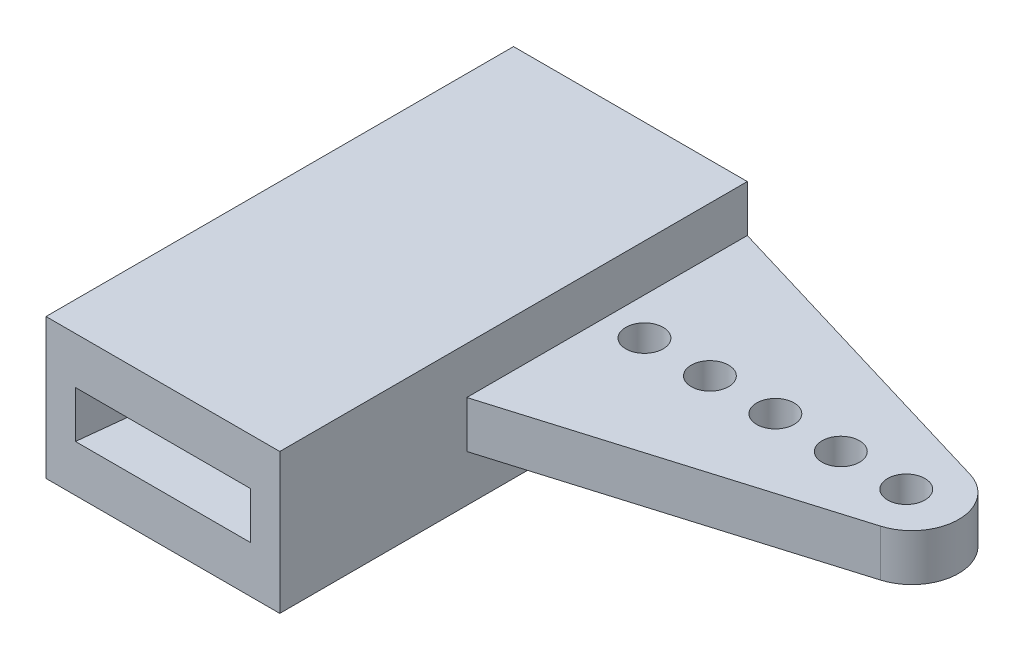
from build123d import *
from build123d.topology import SkipClean

# Parameters (mm, degrees)
SKETCH1_R               = 3.429
SKETCH1_R_2             = 2.286
BOSS_EXTRUDE1_DEPTH     = 3.556
BOSS_EXTRUDE2_START     = -1.27
BOSS_EXTRUDE2_DEPTH     = 1.27
BOSS_EXTRUDE3_START     = -1.27
SKETCH2_3_R             = 2.286
SKETCH2_3_R_2           = 1.27
BOSS_EXTRUDE3_DEPTH     = 0.254
SKETCH3_R               = 0.508
CUT_EXTRUDE1_DEPTH      = 17.020635974
LPATTERN1_COUNT         = 6
LPATTERN1_PITCH         = 1.778
CUT_EXTRUDE2_DEPTH      = 17.020635974
CUT_EXTRUDE2_DEPTH_BACK = 17.020635974
SKETCH4_W               = 4.326879353
SKETCH4_H               = 6.724216597
BOSS_EXTRUDE4_START     = 2.286
SKETCH5_R               = 0.508
BOSS_EXTRUDE4_DEPTH     = 1.27
COMBINE1_OUTLINE_R      = 0.508
COMBINE1_OUTLINE_R_2    = 1.27
COMBINE1_DEPTH          = 3.556
SKETCH6_W               = 6.35
SKETCH6_H               = 12.7
BOSS_EXTRUDE5_DEPTH     = 1.27
BOSS_EXTRUDE6_START     = -1.27
SKETCH6_2_W             = 6.35
SKETCH6_2_H             = 12.7
BOSS_EXTRUDE6_DEPTH     = 1.27
FILLET1_R               = 1.27


# Read off the part's stored shape, not the designer's step: Combine1
with BuildPart() as part:
    # Sketch1 → Boss-Extrude1 (new body)
    with BuildSketch(Plane(origin=(0, 0, 0), x_dir=(1, 0, 0), z_dir=(0, 1, 0))):
        with Locations(Location((0, 0, 0), (0, 0, 270))):
            Circle(SKETCH1_R)
        with Locations(Location((0, 0, 0), (0, 0, 270))):
            Circle(SKETCH1_R_2, mode=Mode.SUBTRACT)
    extrude(amount=BOSS_EXTRUDE1_DEPTH)

    # Sketch2 → Boss-Extrude2 (add)
    with BuildSketch(Plane(origin=(0, 3.556, 0), x_dir=(1, 0, 0), z_dir=(0, 1, 0)).offset(BOSS_EXTRUDE2_START)):
        with BuildLine():
            ThreePointArc((-2.54, 2.303571358), (-1.389081498, 3.135042837), (0, 3.429))
            Line((0, 3.429), (0, 15.24))
            ThreePointArc((0, 15.24), (-0.835660201, 14.92028345), (-1.244511661, 14.124427226))
            Line((-1.244511661, 14.124427226), (-2.54, 2.303571358))
        make_face()
        with BuildLine():
            Line((0, 15.24), (0, 3.429))
            ThreePointArc((0, 3.429), (1.389081498, 3.135042837), (2.54, 2.303571358))
            Line((2.54, 2.303571358), (1.244511661, 14.124427226))
            ThreePointArc((1.244511661, 14.124427226), (0.835660201, 14.92028345), (0, 15.24))
        make_face()
    extrude(amount=BOSS_EXTRUDE2_DEPTH)

    # Sketch2<3> → Boss-Extrude3 (add)
    with BuildSketch(Plane(origin=(0, 3.556, 0), x_dir=(1, 0, 0), z_dir=(0, 1, 0)).offset(BOSS_EXTRUDE3_START)):
        with Locations(Location((0, 0, 0), (0, 0, 270))):
            Circle(SKETCH2_3_R)
        with Locations(Location((0, 0, 0), (0, 0, 270))):
            Circle(SKETCH2_3_R_2, mode=Mode.SUBTRACT)
    extrude(amount=BOSS_EXTRUDE3_DEPTH)

    # Sketch3 → Cut-Extrude1 (cut, through all)
    with BuildSketch(Plane(origin=(0, 3.556, 0), x_dir=(1, 0, 0), z_dir=(0, 1, 0))):
        with Locations(Location((0, 5.08, 0), (0, 0, 270))):
            Circle(SKETCH3_R)
    cut_extrude1 = extrude(amount=-CUT_EXTRUDE1_DEPTH, mode=Mode.SUBTRACT)

    # LPattern1: Cut-Extrude1 ×6
    with Locations(*[(0, 0, -i * LPATTERN1_PITCH) for i in range(1, LPATTERN1_COUNT)]):
        add(cut_extrude1, mode=Mode.SUBTRACT)

    # Sketch4 → Cut-Extrude2 (cut, two sides: drawn at the far end of the back side and taken through both)
    with BuildSketch(Plane(origin=(0, 0, 0), x_dir=(0, 0, -1), z_dir=(1, 0, 0)).offset(-CUT_EXTRUDE2_DEPTH_BACK)):
        with Locations((-2.163439677, 3.362108299)):
            Rectangle(SKETCH4_W, SKETCH4_H)
    extrude(amount=CUT_EXTRUDE2_DEPTH + CUT_EXTRUDE2_DEPTH_BACK, mode=Mode.SUBTRACT)

    # Mirror1: part across plane


with BuildPart() as part_1:
    with SkipClean():  # the faces are left unmerged after this step: merging them gives an invalid solid
        add(part.part)
        add(part.part.mirror(Plane.XY))


with BuildPart() as body_2:
    # Sketch5 → Boss-Extrude4 (new body)
    with BuildSketch(Plane(origin=(0, 0, 0), x_dir=(1, 0, 0), z_dir=(0, 1, 0)).offset(BOSS_EXTRUDE4_START)):
        Polygon((3.175, 16.51), (15.875, 12.7), (3.175, 8.89), (3.175, 3.81), (-3.175, 3.81), (-3.175, 16.51), align=None)
        with Locations(Location((4.191, 12.7, 0), (0, 0, 270))):
            Circle(SKETCH5_R, mode=Mode.SUBTRACT)
        with Locations(Location((5.969, 12.7, 0), (0, 0, 270))):
            Circle(SKETCH5_R, mode=Mode.SUBTRACT)
        with Locations(Location((7.747, 12.7, 0), (0, 0, 270))):
            Circle(SKETCH5_R, mode=Mode.SUBTRACT)
        with Locations(Location((9.525, 12.7, 0), (0, 0, 270))):
            Circle(SKETCH5_R, mode=Mode.SUBTRACT)
        with Locations(Location((11.303, 12.7, 0), (0, 0, 270))):
            Circle(SKETCH5_R, mode=Mode.SUBTRACT)
    extrude(amount=BOSS_EXTRUDE4_DEPTH)


with BuildPart() as combine1_tool:
    # Combine1 outline → Combine1 (new body)
    with BuildSketch(Plane(origin=(0, 0, 0), x_dir=(1, 0, 0), z_dir=(0, 1, 0))):
        with BuildLine():
            ThreePointArc((2.54, -2.303571358), (3.429, 0), (2.54, 2.303571358))
            Line((2.54, 2.303571358), (1.244511661, 14.124427226))
            ThreePointArc((1.244511661, 14.124427226), (0, 15.24), (-1.244511661, 14.124427226))
            Line((-1.244511661, 14.124427226), (-2.54, 2.303571358))
            ThreePointArc((-2.54, 2.303571358), (-3.429, 0), (-2.54, -2.303571358))
            Line((-2.54, -2.303571358), (-1.244511661, -14.124427226))
            ThreePointArc((-1.244511661, -14.124427226), (0, -15.24), (1.244511661, -14.124427226))
            Line((1.244511661, -14.124427226), (2.54, -2.303571358))
        make_face()
        with Locations((0, -5.08)):
            Circle(COMBINE1_OUTLINE_R, mode=Mode.SUBTRACT)
        with Locations((0, -13.97)):
            Circle(COMBINE1_OUTLINE_R, mode=Mode.SUBTRACT)
        with Locations((0, -12.192)):
            Circle(COMBINE1_OUTLINE_R, mode=Mode.SUBTRACT)
        with Locations((0, -10.414)):
            Circle(COMBINE1_OUTLINE_R, mode=Mode.SUBTRACT)
        with Locations((0, -8.636)):
            Circle(COMBINE1_OUTLINE_R, mode=Mode.SUBTRACT)
        with Locations((0, -6.858)):
            Circle(COMBINE1_OUTLINE_R, mode=Mode.SUBTRACT)
        Circle(COMBINE1_OUTLINE_R_2, mode=Mode.SUBTRACT)
    extrude(amount=COMBINE1_DEPTH)


with BuildPart() as part_2:
    add(part_1.part)

    # Combine1: cut by combine1_tool
    add(combine1_tool.part, mode=Mode.SUBTRACT)


with BuildPart() as body_2_1:
    add(body_2.part)

    # Combine1: cut by combine1_tool
    add(combine1_tool.part, mode=Mode.SUBTRACT)

    # Sketch6 → Boss-Extrude5 (add)
    with BuildSketch(Plane.XZ.offset(-2.286)):
        with Locations((0, -10.16)):
            Rectangle(SKETCH6_W, SKETCH6_H)
    extrude(amount=BOSS_EXTRUDE5_DEPTH)

    # Sketch6<2> → Boss-Extrude6 (add)
    with BuildSketch(Plane.XZ.offset(-2.286).offset(BOSS_EXTRUDE6_START)):
        with Locations((0, -10.16)):
            Rectangle(SKETCH6_2_W, SKETCH6_2_H)
    extrude(amount=-BOSS_EXTRUDE6_DEPTH)

    # Fillet1
    fillet1_edges = [body_2_1.edges().sort_by_distance(p)[0] for p in [
        (15.875, 2.921, -12.7),
    ]]
    fillet(fillet1_edges, radius=FILLET1_R)


solid = body_2_1.part
